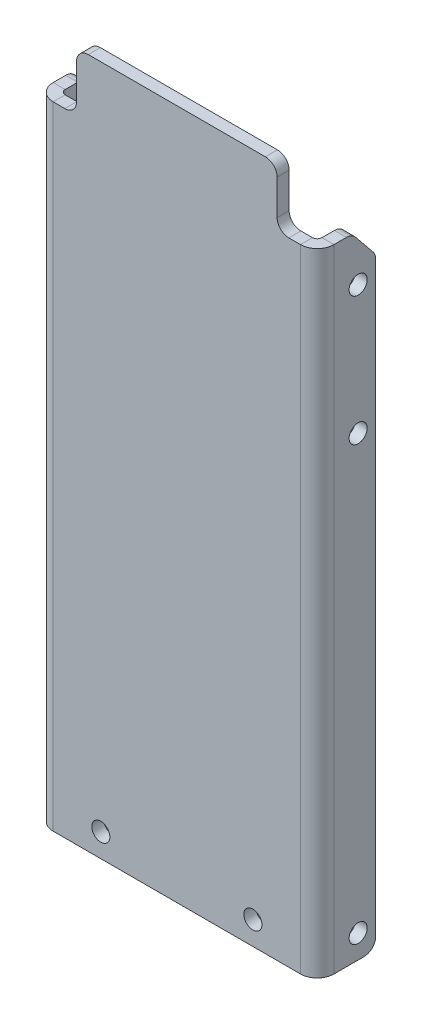
from build123d import *
from OCP.BRepFilletAPI import BRepFilletAPI_MakeChamfer

# Parameters (mm, degrees)
SKETCH1_W                      = 76.2
SKETCH1_H                      = 171.45
BASE_FLANGE1_DEPTH             = 3.2639
EDGE_FLANGE1_STRIP_W           = 15.5956
EDGE_FLANGE1_STRIP_H           = 3.2639
EDGE_FLANGE1_STRIP_CUT_DEPTH   = 171.45
EDGE_FLANGE1_STRIP_2_W         = 15.5956
EDGE_FLANGE1_STRIP_2_H         = 3.2639
EDGE_FLANGE1_STRIP_CUT_2_DEPTH = 171.45
EDGE_FLANGE1_DEPTH             = 171.45
EDGE_FLANGE1_BEND_DEPTH        = 171.45
F_10_0_1935_DIAMETER_HOLE1_D   = 4.9149
SKETCH33_W                     = 54.4322
SKETCH33_H                     = 15.875
BOSS_EXTRUDE1_DEPTH            = 3.2639
CHAMFER1_SIZE                  = 7.9375
CHAMFER1_SIZE2                 = 6.427660763
F_10_0_1935_DIAMETER_HOLE2_D   = 4.9149
FILLET1_R                      = 3.175


# Sheet-metal steps are written as plain solids
with BuildPart() as part:
    # Sketch1 → Base-Flange1 (new body)
    with BuildSketch(Plane.XY):
        with Locations((0, 38.396418)):
            Rectangle(SKETCH1_W, SKETCH1_H)
    extrude(amount=-BASE_FLANGE1_DEPTH)

    # Edge-Flange1 strip (across the edge) → Edge-Flange1 strip cut (cut)
    with BuildSketch(Plane(origin=(38.1, 124.121418, -3.2639), x_dir=(-1, 0, 0), z_dir=(0, -1, 0))):
        with Locations((-3.2639, -1.63195)):
            Rectangle(EDGE_FLANGE1_STRIP_W, EDGE_FLANGE1_STRIP_H)
    extrude(amount=EDGE_FLANGE1_STRIP_CUT_DEPTH, mode=Mode.SUBTRACT)

    # Edge-Flange1 strip 2 (across the edge) → Edge-Flange1 strip cut 2 (cut)
    with BuildSketch(Plane(origin=(-38.1, -47.328582, -3.2639), x_dir=(1, 0, 0), z_dir=(0, 1, 0))):
        with Locations((-3.2639, -1.63195)):
            Rectangle(EDGE_FLANGE1_STRIP_2_W, EDGE_FLANGE1_STRIP_2_H)
    extrude(amount=EDGE_FLANGE1_STRIP_CUT_2_DEPTH, mode=Mode.SUBTRACT)

    # Edge-Flange1 section (across the edge) → Edge-Flange1 (add)
    with BuildSketch(Plane(origin=(38.1, 124.121418, -3.2639), x_dir=(-1, 0, 0), z_dir=(0, -1, 0))):
        with BuildLine():
            Line((0, 1.27), (0, 12.6111))
            Line((0, 12.6111), (3.2639, 12.6111))
            Line((3.2639, 12.6111), (3.2639, 1.27))
            ThreePointArc((3.2639, 1.27), (3.635874388, 0.371974388), (4.5339, 0))
            Line((4.5339, 0), (4.5339, -3.2639))
            ThreePointArc((4.5339, -3.2639), (1.327948565, -1.935951435), (0, 1.27))
        make_face()
    extrude(amount=EDGE_FLANGE1_DEPTH)

    # Edge-Flange1 section 2 (across the edge) → Edge-Flange1 bend (add)
    with BuildSketch(Plane(origin=(-38.1, -47.328582, -3.2639), x_dir=(1, 0, 0), z_dir=(0, 1, 0))):
        with BuildLine():
            Line((0, 1.27), (0, 12.6111))
            Line((0, 12.6111), (3.2639, 12.6111))
            Line((3.2639, 12.6111), (3.2639, 1.27))
            ThreePointArc((3.2639, 1.27), (3.635874388, 0.371974388), (4.5339, 0))
            Line((4.5339, 0), (4.5339, -3.2639))
            ThreePointArc((4.5339, -3.2639), (1.327948565, -1.935951435), (0, 1.27))
        make_face()
    extrude(amount=EDGE_FLANGE1_BEND_DEPTH)

    # #10 (0.1935) Diameter Hole1 (through all)
    with Locations(Plane(origin=(38.1, 0, 0), x_dir=(0, 0, -1), z_dir=(1, 0, 0))):
        with Locations((11.1125, 76.496418), (11.1125, -40.978582), (11.1125, 111.421418)):
            Hole(F_10_0_1935_DIAMETER_HOLE1_D / 2)

    # Sketch33 → Boss-Extrude1 (add)
    with BuildSketch(Plane.XY):
        with Locations((0, 132.058918)):
            Rectangle(SKETCH33_W, SKETCH33_H)
    extrude(amount=-BOSS_EXTRUDE1_DEPTH)

    # Chamfer1: one chamfer whose edges measure the first distance from different faces: ONE call of the kernel's chamfer builder (chamfer() names one face for all edges)
    chamfer1_edges_1 = [part.edges().sort_by_distance(p)[0] for p in [
        (36.46805, 124.121418, -15.875),
    ]]
    chamfer1_side_1 = [part.faces().sort_by_distance(p)[0] for p in [
        (36.46805, 38.396418, -15.875),
    ]]
    chamfer1_edges_2 = [part.edges().sort_by_distance(p)[0] for p in [
        (-36.46805, 124.121418, -15.875),
    ]]
    chamfer1_side_2 = [part.faces().sort_by_distance(p)[0] for p in [
        (-36.46805, 38.396418, -15.875),
    ]]
    chamfer1 = BRepFilletAPI_MakeChamfer(part.part.solid().wrapped)
    for e in chamfer1_edges_1:
        chamfer1.Add(CHAMFER1_SIZE, CHAMFER1_SIZE2, e.wrapped, chamfer1_side_1[0].wrapped)  # the first distance lies on this face
    for e in chamfer1_edges_2:
        chamfer1.Add(CHAMFER1_SIZE, CHAMFER1_SIZE2, e.wrapped, chamfer1_side_2[0].wrapped)  # the first distance lies on this face
    add(Compound.cast(chamfer1.Shape()), mode=Mode.REPLACE)

    # #10 (0.1935) Diameter Hole2 (through all)
    with Locations(Plane.XY):
        with Locations((-20.6375, -40.978582), (20.6375, -40.978582)):
            Hole(F_10_0_1935_DIAMETER_HOLE2_D / 2)

    # Fillet1
    fillet1_edges = [part.edges().sort_by_distance(p)[0] for p in [
        (-27.2161, 124.121418, -1.63195),
        (-27.2161, 139.996418, -1.63195),
        (27.2161, 139.996418, -1.63195),
        (27.2161, 124.121418, -1.63195),
        (-36.46805, 116.183918, -15.875),
        (-36.46805, 124.121418, -9.447339237),
        (36.46805, 124.121418, -9.447339237),
        (36.46805, 116.183918, -15.875),
        (36.46805, -47.328582, -15.875),
        (-36.46805, -47.328582, -15.875),
    ]]
    fillet(fillet1_edges, radius=FILLET1_R)


solid = part.part
